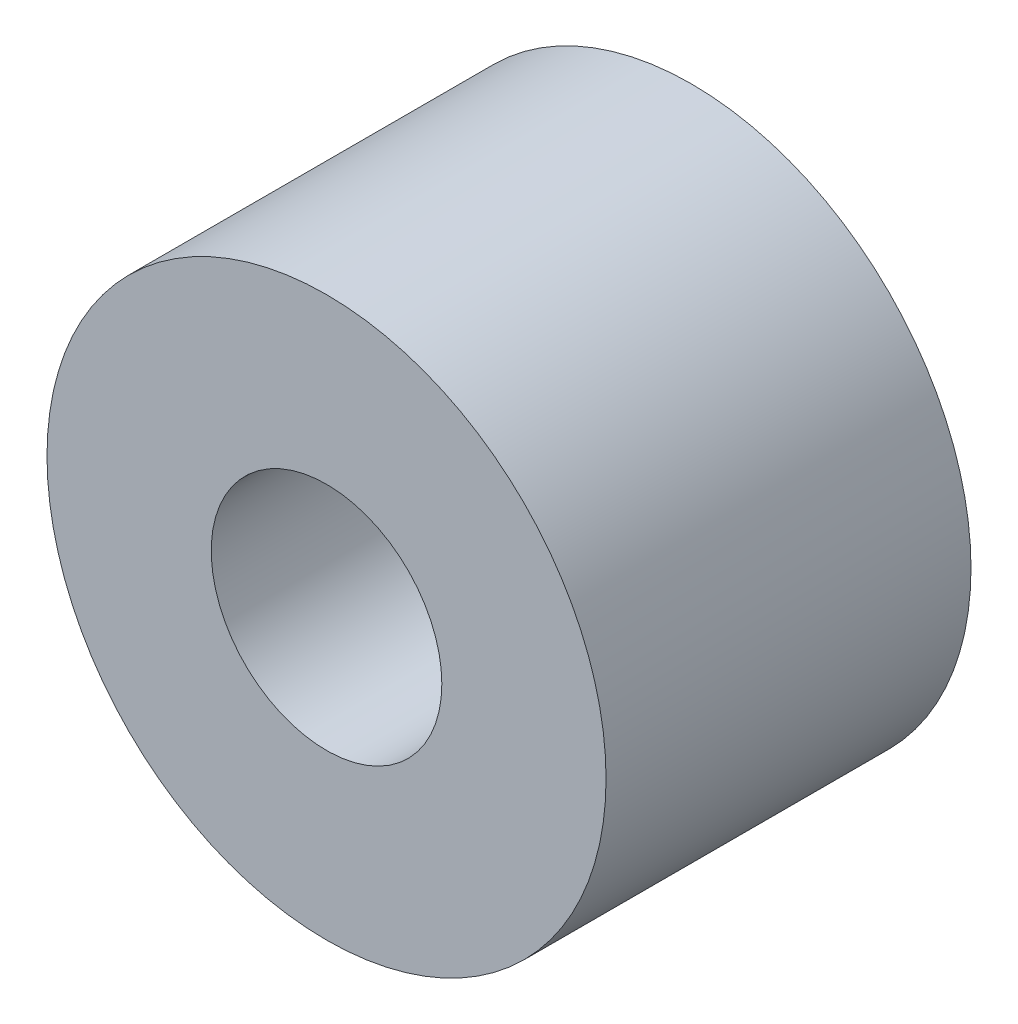
from build123d import *

# Parameters (mm, degrees)
SKETCH1_R           = 2.25
SKETCH1_R_2         = 1.65
BOSS_EXTRUDE1_DEPTH = 1
SKETCH2_R           = 4
SKETCH2_R_2         = 1.65
BOSS_EXTRUDE2_DEPTH = 5
CHAMFER1_SIZE       = 1
CHAMFER1_SIZE_2     = 2.25


with BuildPart() as part:
    # Sketch1 → Boss-Extrude1 (new body)
    with BuildSketch(Plane.XY):
        Circle(SKETCH1_R)
        Circle(SKETCH1_R_2, mode=Mode.SUBTRACT)
    extrude(amount=BOSS_EXTRUDE1_DEPTH)

    # Sketch2 → Boss-Extrude2 (add)
    with BuildSketch(Plane.XY.offset(1)):
        Circle(SKETCH2_R)
        Circle(SKETCH2_R_2, mode=Mode.SUBTRACT)
    extrude(amount=BOSS_EXTRUDE2_DEPTH)

    # Chamfer1
    # the kernel refuses this chamfer: 2.25, 1 mm, written as the material it adds along each edge
    with BuildSketch(Plane(origin=(0, 0, 1), x_dir=(1, 0, 0), z_dir=(0, -1, 0))) as chamfer1_piece_1_section:
        Polygon((2.25, -CHAMFER1_SIZE), (2.25 + CHAMFER1_SIZE_2, 0), (2.25, 0), align=None)
    chamfer1_piece_1 = revolve(axis=Axis((0, 0, 1), (0, 0, 1)), mode=Mode.PRIVATE)
    chamfer1_piece_1 = split(chamfer1_piece_1, bisect_by=Plane(origin=(-3.113599445, 0, 0), z_dir=(0, 0, 1)), keep=Keep.TOP, mode=Mode.PRIVATE)
    chamfer1_piece_1 = chamfer1_piece_1 & Plane(origin=(0, 0, 0.414540138), x_dir=(1, 0, 0), z_dir=(0, 0, -1)) * Cylinder(4, 18, mode=Mode.PRIVATE)
    add(chamfer1_piece_1)


solid = part.part
